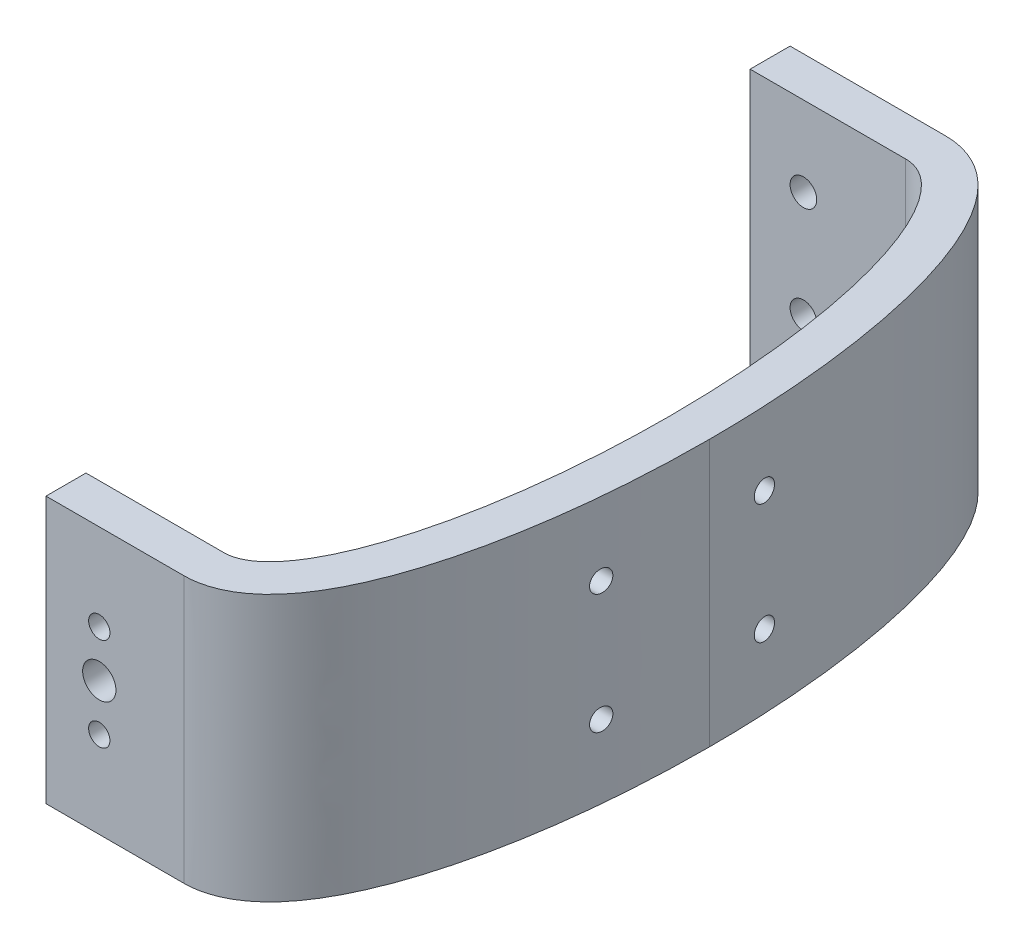
from build123d import *

# Parameters (mm, degrees)
EXTRUDE_1_DEPTH     = 40
SKETCH_2_W          = 20.699792116
SKETCH_2_H          = 40
EXTRUDE_2_DEPTH     = 6
SKETCH_3_W          = 23.355434
SKETCH_3_H          = 40
EXTRUDE_3_DEPTH     = 6
SKETCH_4_R          = 1.6
SKETCH_4_R_2        = 2.5
CUT_EXTRUDE_1_DEPTH = 6
SKETCH_5_R          = 2
CUT_EXTRUDE_2_DEPTH = 6
SKETCH_6_R          = 1.6
CUT_EXTRUDE_3_DEPTH = 50
SKETCH_7_R          = 3
CUT_EXTRUDE_4_DEPTH = 8.5


with BuildPart() as part:
    # 草图1 → 凸台-拉伸1 (new body)
    with BuildSketch(Plane(origin=(0, 20, 0), x_dir=(-1, 0, 0), z_dir=(0, -1, 0))):
        with BuildLine():
            Line((-222.278378746, 60.718506671), (-222.278378746, 54.718506671))
            add(Edge.make_bspline(
                [(-222.278378746, 54.718506671), (-230.961190407, 54.718506671), (-238, 31.801176865), (-238, 3.53121788)],
                knots=[0, 0, 0, 0, 1, 1, 1, 1], degree=3))
            add(Edge.make_bspline(
                [(-238, 3.53121788), (-238, -24.738741104), (-230.961190407, -47.656070911), (-222.278378746, -47.656070911)],
                knots=[0, 0, 0, 0, 1, 1, 1, 1], degree=3))
            Line((-222.278378746, -47.656070911), (-222.278378746, -53.656070911))
            add(Edge.make_bspline(
                [(-222.278378746, -53.656070911), (-223.180271244, -53.656070911), (-224.07933128, -53.571054967), (-224.960759777, -53.401588789), (-225.809203297, -53.154351153), (-226.615610963, -52.841063111), (-227.377447744, -52.473741453), (-228.814318367, -51.648078689), (-230.088209946, -50.667712485), (-230.687109525, -50.145609931), (-231.252366306, -49.596041043), (-231.788248358, -49.021505836), (-232.298365535, -48.423329927), (-233.760558431, -46.560400285), (-235.040687912, -44.496180714), (-235.833189955, -43.034044994), (-236.575699117, -41.484412798), (-237.274068793, -39.847154711), (-237.931584122, -38.12373571), (-239.787454092, -32.699420286), (-241.30112649, -26.534876341), (-242.165253789, -22.115163123), (-242.876330308, -17.414243288), (-243.426543113, -12.464468584), (-243.804818267, -7.299999889), (-244, -1.956138547), (-244, 3.53121788)],
                knots=[0, 0, 0, 0, 0, 0, 0, 0, 0, 0.125, 0.125, 0.125, 0.125, 0.125, 0.125, 0.25, 0.25, 0.25, 0.25, 0.25, 0.25, 0.5, 0.5, 0.5, 0.5, 0.5, 0.5, 1, 1, 1, 1, 1, 1, 1, 1, 1], degree=8))
            add(Edge.make_bspline(
                [(-244, 3.53121788), (-244, 9.018574307), (-243.804818267, 14.362435649), (-243.426543113, 19.526904345), (-242.876330308, 24.476679049), (-242.165253789, 29.177598883), (-241.30112649, 33.597312101), (-239.787454092, 39.761856046), (-237.931584122, 45.186171471), (-237.274068793, 46.909590472), (-236.575699117, 48.546848558), (-235.833189955, 50.096480754), (-235.040687912, 51.558616474), (-233.760558431, 53.622836045), (-232.298365535, 55.485765688), (-231.788248358, 56.083941596), (-231.252366306, 56.658476803), (-230.687109525, 57.208045691), (-230.088209946, 57.730148246), (-228.814318367, 58.710514449), (-227.377447744, 59.536177213), (-226.615610963, 59.903498872), (-225.809203297, 60.216786914), (-224.960759777, 60.464024549), (-224.07933128, 60.633490728), (-223.180271244, 60.718506671), (-222.278378746, 60.718506671)],
                knots=[0, 0, 0, 0, 0, 0, 0, 0, 0, 0.5, 0.5, 0.5, 0.5, 0.5, 0.5, 0.75, 0.75, 0.75, 0.75, 0.75, 0.75, 0.875, 0.875, 0.875, 0.875, 0.875, 0.875, 1, 1, 1, 1, 1, 1, 1, 1, 1], degree=8))
        make_face()
    extrude(amount=EXTRUDE_1_DEPTH)

    # 草图2 → 凸台-拉伸2 (add)
    with BuildSketch(Plane.XY.offset(47.656070911)):
        with Locations((211.928482688, 0)):
            Rectangle(SKETCH_2_W, SKETCH_2_H)
    extrude(amount=EXTRUDE_2_DEPTH)

    # 草图3 → 凸台-拉伸3 (add)
    with BuildSketch(Plane.XY.offset(-60.718506671)):
        with Locations((210.600661746, 0)):
            Rectangle(SKETCH_3_W, SKETCH_3_H)
    extrude(amount=EXTRUDE_3_DEPTH)

    # 草图4 → 切除-拉伸1 (cut)
    with BuildSketch(Plane.XY.offset(47.656070911)):
        with Locations((209.57858663, -7)):
            Circle(SKETCH_4_R)
        with Locations((209.57858663, 7)):
            Circle(SKETCH_4_R)
        with Locations((209.57858663, 0)):
            Circle(SKETCH_4_R_2)
    extrude(amount=CUT_EXTRUDE_1_DEPTH, mode=Mode.SUBTRACT)

    # 草图5 → 切除-拉伸2 (cut)
    with BuildSketch(Plane.XY.offset(-60.718506671)):
        with Locations((206.922944746, -8)):
            Circle(SKETCH_5_R)
        with Locations((206.922944746, 8)):
            Circle(SKETCH_5_R)
    extrude(amount=CUT_EXTRUDE_2_DEPTH, mode=Mode.SUBTRACT)

    # 草图6 → 切除-拉伸3 (cut)
    with BuildSketch(Plane(origin=(285, 0, 0), x_dir=(0, 0, -1), z_dir=(1, 0, 0))):
        with Locations((12, -9)):
            Circle(SKETCH_6_R)
        with Locations((-12, -9)):
            Circle(SKETCH_6_R)
        with Locations((12, 9)):
            Circle(SKETCH_6_R)
        with Locations((-12, 9)):
            Circle(SKETCH_6_R)
    extrude(amount=-CUT_EXTRUDE_3_DEPTH, mode=Mode.SUBTRACT)

    # 草图7 → 切除-拉伸4 (cut)
    with BuildSketch(Plane(origin=(230, 0, 0), x_dir=(0, 0, -1), z_dir=(1, 0, 0))):
        with Locations((12, -9)):
            Circle(SKETCH_7_R)
        with Locations((-12, -9)):
            Circle(SKETCH_7_R)
        with Locations((12, 9)):
            Circle(SKETCH_7_R)
        with Locations((-12, 9)):
            Circle(SKETCH_7_R)
    extrude(amount=CUT_EXTRUDE_4_DEPTH, mode=Mode.SUBTRACT)


solid = part.part
